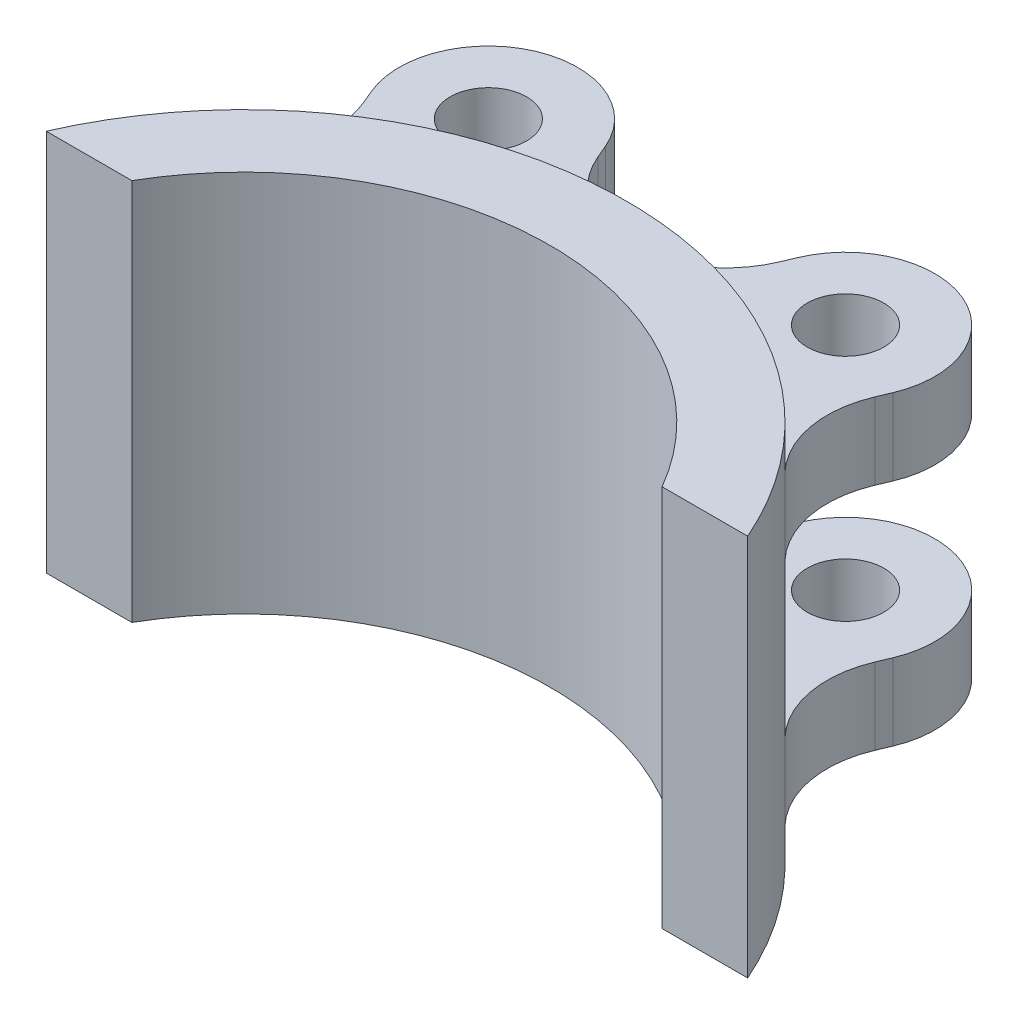
from build123d import *

# Parameters (mm, degrees)
BOSS_EXTRU_1_DEPTH           = 7.5
ESQUISSE2_R                  = 1.5
BOSS_EXTRU_2_DEPTH           = 6
CONG_2_R                     = 4
CONG_2_OF_SYM_TRIE1_R        = 4
ENL_V_MAT_EXTRU_1_DEPTH      = 3
ENL_V_MAT_EXTRU_1_DEPTH_BACK = 3
ESQUISSE3_R                  = 23.003278447
ESQUISSE3_R_2                = 15


with BuildPart() as part:
    # Esquisse1 → Boss.-Extru.1 (new, symmetric)
    with BuildSketch(Plane(origin=(0, 0, 0), x_dir=(1, 0, 0), z_dir=(0, 1, 0))):
        with BuildLine():
            Line((0, 15), (0, 12))
            ThreePointArc((0, 12), (-6, 10.392304845), (-10.392304845, 6))
            Line((-10.392304845, 6), (-13.747727085, 6))
            ThreePointArc((-13.747727085, 6), (-8.215838363, 12.549900398), (0, 15))
        make_face()
    boss_extru_1 = extrude(amount=BOSS_EXTRU_1_DEPTH, both=True)

    # Esquisse2 → Boss.-Extru.2 (add, symmetric)
    with BuildSketch(Plane(origin=(0, 0, 0), x_dir=(1, 0, 0), z_dir=(0, 1, 0))):
        with BuildLine():
            Line((-10.224496324, 15.222012841), (-8.896811047, 12.07670291))
            ThreePointArc((-8.896811047, 12.07670291), (-5.833333333, 13.81926996), (-2.447818399, 14.798925133))
            Line((-2.447818399, 14.798925133), (-3.775503676, 17.944235063))
            ThreePointArc((-3.775503676, 17.944235063), (-8.361111111, 19.807620276), (-10.224496324, 15.222012841))
        make_face()
        with Locations(Location((-7, 16.583123952, 0), (0, 0, 270))):
            Circle(ESQUISSE2_R, mode=Mode.SUBTRACT)
    boss_extru_2 = extrude(amount=BOSS_EXTRU_2_DEPTH, both=True)

    # Congé2
    # the kernel refuses this fillet: 4 mm, written as the material it adds along each edge
    with BuildSketch(Plane(origin=(-2.447818399, -6, -14.798925133), x_dir=(0.9966431178830178, 0, -0.0818687704586858), z_dir=(0, 1, 0))) as cong_2_piece_1:
        with BuildLine():
            CenterArc((2.904362046, 3.974799123), CONG_2_R, 198.189389649, 65.375681648)
            Line((-0.895757454, 2.726163155), (-0.971759844, 2.701190435))
            Line((-0.971759844, 2.701190435), (-0.07600239, -0.024972719))
            Line((-0.07600239, -0.024972719), (0.006549502, -0.079731449))
            ThreePointArc((0.006549502, -0.079731449), (1.228031557, -0.029646768), (2.447097135, -0.079495982))
            Line((2.447097135, -0.079495982), (2.456063114, 0))
        make_face()
    extrude(amount=12)
    with BuildSketch(Plane(origin=(-8.896811047, -6, -12.07670291), x_dir=(-0.7517608452817168, 0, 0.6594358433549989), z_dir=(0, 1, 0))) as cong_2_piece_2:
        with BuildLine():
            CenterArc((2.891216238, -3.985511596), CONG_2_R, 94.878081885, 66.750437409)
            Line((-0.904915803, -2.724804838), (-0.980838444, -2.699590703))
            Line((-0.980838444, -2.699590703), (-0.075922641, 0.025214135))
            Line((-0.075922641, 0.025214135), (0.006802862, 0.079710232))
            ThreePointArc((0.006802862, 0.079710232), (1.275536575, 0.025668484), (2.544270289, 0.079710232))
            Line((2.544270289, 0.079710232), (2.551073151, 0))
        make_face()
    extrude(amount=12)

    # Symétrie1: Boss.-Extru.1, Boss.-Extru.2 across plane
    add(boss_extru_1.mirror(Plane(origin=(0, -7.5, -15), x_dir=(0, 0, 1), z_dir=(1, 0, 0))))
    add(boss_extru_2.mirror(Plane(origin=(0, -7.5, -15), x_dir=(0, 0, 1), z_dir=(1, 0, 0))))

    # Congé2 of Symétrie1
    # the kernel refuses this fillet: 4 mm, written as the material it adds along each edge
    with BuildSketch(Plane(origin=(2.447818399, -6, -14.798925133), x_dir=(-0.9966431178830035, 0, -0.08186877045886062), z_dir=(0, 1, 0))) as cong_2_of_sym_trie1_piece_1:
        with BuildLine():
            CenterArc((2.904362046, -3.974799123), CONG_2_OF_SYM_TRIE1_R, 96.434928703, 65.375681648)
            Line((-0.895757454, -2.726163155), (-0.971759844, -2.701190435))
            Line((-0.971759844, -2.701190435), (-0.07600239, 0.024972719))
            Line((-0.07600239, 0.024972719), (0.006549502, 0.079731449))
            ThreePointArc((0.006549502, 0.079731449), (1.228031557, 0.029646768), (2.447097135, 0.079495982))
            Line((2.447097135, 0.079495982), (2.456063114, 0))
        make_face()
    extrude(amount=12)
    with BuildSketch(Plane(origin=(8.896811047, -6, -12.07670291), x_dir=(0.7517608452817176, 0, 0.6594358433549979), z_dir=(0, 1, 0))) as cong_2_of_sym_trie1_piece_2:
        with BuildLine():
            CenterArc((2.891216238, 3.985511596), CONG_2_OF_SYM_TRIE1_R, 198.371480706, 66.750437409)
            Line((-0.904915803, 2.724804838), (-0.980838444, 2.699590703))
            Line((-0.980838444, 2.699590703), (-0.075922641, -0.025214135))
            Line((-0.075922641, -0.025214135), (0.006802862, -0.079710232))
            ThreePointArc((0.006802862, -0.079710232), (1.275536575, -0.025668484), (2.544270289, -0.079710232))
            Line((2.544270289, -0.079710232), (2.551073151, 0))
        make_face()
    extrude(amount=12)

    # Esquisse3 → Enlèv. mat.-Extru.1 (cut, two sides: drawn at the far end of the back side and taken through both)
    with BuildSketch(Plane(origin=(0, 0, 0), x_dir=(1, 0, 0), z_dir=(0, 1, 0)).offset(-ENL_V_MAT_EXTRU_1_DEPTH_BACK)):
        Circle(ESQUISSE3_R)
        Circle(ESQUISSE3_R_2, mode=Mode.SUBTRACT)
    extrude(amount=ENL_V_MAT_EXTRU_1_DEPTH + ENL_V_MAT_EXTRU_1_DEPTH_BACK, mode=Mode.SUBTRACT)


solid = part.part
